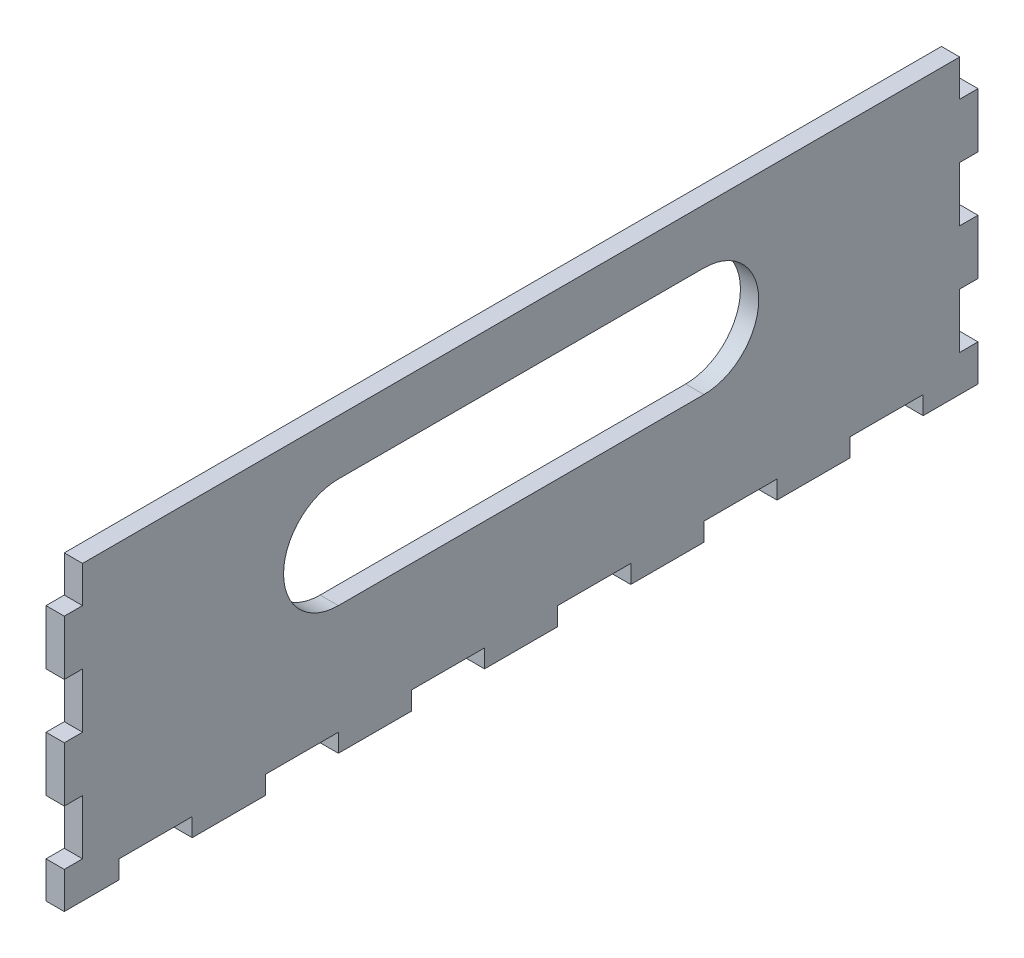
from build123d import *

# Parameters (mm, degrees)
BOSS_EXTRUDE1_DEPTH = 6.35


with BuildPart() as part:
    # Sketch2 → Boss-Extrude1 (new body)
    with BuildSketch(Plane(origin=(0, 0, 0), x_dir=(0, 0, -1), z_dir=(1, 0, 0))):
        Polygon((-152.4, 101.6), (152.4, 101.6), (152.4, 88.9), (158.75, 88.9), (158.75, 69.85), (152.4, 69.85), (152.4, 50.8), (158.75, 50.8), (158.75, 31.75), (152.4, 31.75), (152.4, 12.7), (158.75, 12.7), (158.75, 0), (139.7, 0), (139.7, 6.35), (114.3, 6.35), (114.3, 0), (88.9, 0), (88.9, 6.35), (63.5, 6.35), (63.5, 0), (38.1, 0), (38.1, 6.35), (12.7, 6.35), (12.7, 0), (-12.7, 0), (-12.7, 6.35), (-38.1, 6.35), (-38.1, 0), (-63.5, 0), (-63.5, 6.35), (-88.9, 6.35), (-88.9, 0), (-114.3, 0), (-114.3, 6.35), (-139.7, 6.35), (-139.7, 0), (-158.75, 0), (-158.75, 12.7), (-152.4, 12.7), (-152.4, 31.75), (-158.75, 31.75), (-158.75, 50.8), (-152.4, 50.8), (-152.4, 69.85), (-158.75, 69.85), (-158.75, 88.9), (-152.4, 88.9), align=None)
        with BuildLine():
            Line((-63.5, 82.55), (63.5, 82.55))
            ThreePointArc((63.5, 82.55), (82.55, 63.5), (63.5, 44.45))
            Line((63.5, 44.45), (-63.5, 44.45))
            ThreePointArc((-63.5, 44.45), (-82.55, 63.5), (-63.5, 82.55))
        make_face(mode=Mode.SUBTRACT)
    extrude(amount=BOSS_EXTRUDE1_DEPTH)


solid = part.part
